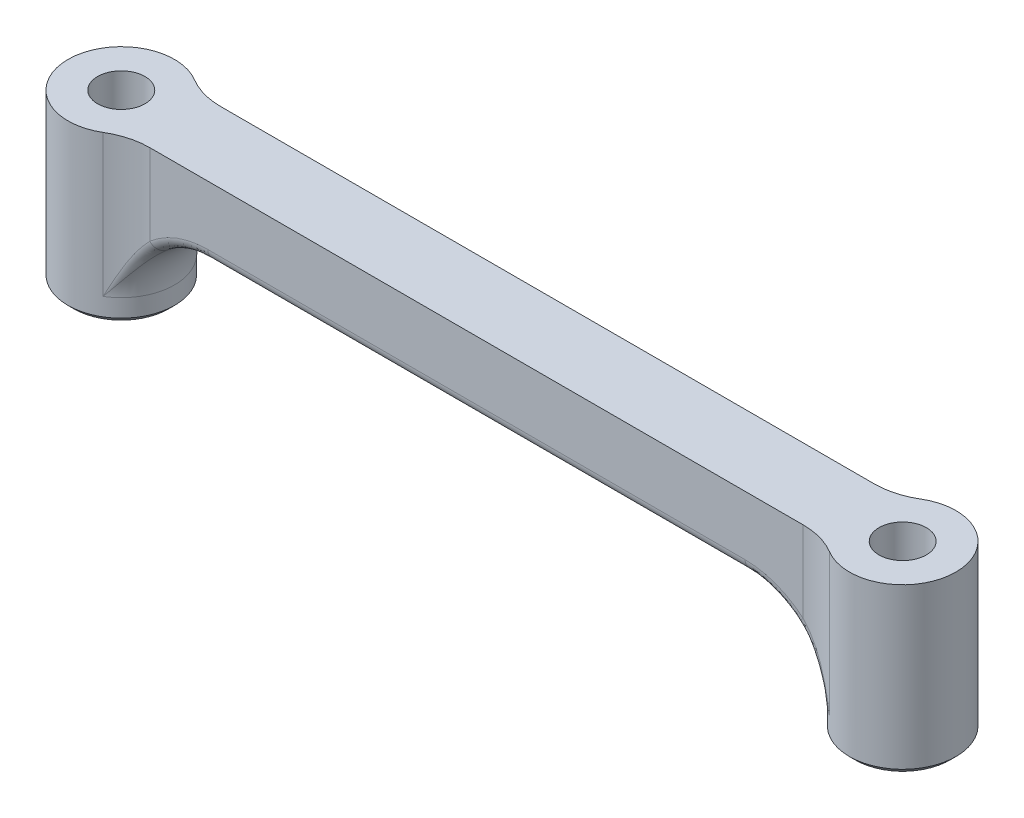
from build123d import *

# Parameters (mm, degrees)
SKETCH1_R           = 1.0000000000000016
BOSS_EXTRUDE1_DEPTH = 3
BOSS_EXTRUDE2_START = -4
SKETCH1_3_R         = 2.25
SKETCH1_3_R_2       = 1.0000000000000016
BOSS_EXTRUDE2_DEPTH = 4
FILLET1_R           = 3
FILLET2_R           = 0.5
CHAMFER1_SIZE       = 0.25


with BuildPart() as part:
    # Sketch1 → Boss-Extrude1 (new body)
    with BuildSketch(Plane(origin=(0, 0, 0), x_dir=(1, 0, 0), z_dir=(0, 1, 0))):
        with BuildLine():
            Line((0, 1.5), (-14.82294901687516, 1.5))
            ThreePointArc((-14.822949016875159, 1.5000000000000018), (-18.75, -7.2e-16), (-14.822949016875159, -1.5000000000000013))
            Line((-14.82294901687516, -1.5), (0, -1.5))
            Line((3.8e-16, -1.5), (3.8e-16, 1.5))
        make_face()
        with Locations((-16.5, 0)):
            Circle(SKETCH1_R, mode=Mode.SUBTRACT)
    extrude(amount=BOSS_EXTRUDE1_DEPTH)

    # Sketch1<3> → Boss-Extrude2 (add)
    with BuildSketch(Plane(origin=(0, 0, 0), x_dir=(1, 0, 0), z_dir=(0, 1, 0)).offset(BOSS_EXTRUDE2_START)):
        with Locations((-16.5, 2.2e-16)):
            Circle(SKETCH1_3_R)
        with Locations((-16.5, 0)):
            Circle(SKETCH1_3_R_2, mode=Mode.SUBTRACT)
    extrude(amount=BOSS_EXTRUDE2_DEPTH)

    # Fillet1
    fillet1_edges = [part.edges().sort_by_distance(p)[0] for p in [
        (-14.39811219233389, 0, 0.8028497019894529),
        (-14.82294901687516, 1.5, -1.5000000000000009),
        (-14.82294901687516, 1.5, 1.5000000000000007),
    ]]
    fillet(fillet1_edges, radius=FILLET1_R)

    # Mirror1: part across plane


with BuildPart() as part_1:
    add(part.part)
    add(part.part.mirror(Plane(origin=(0, 3, 0), x_dir=(0, 0, 1), z_dir=(1, 0, 0))))

    # Fillet2
    fillet2_edges = [part_1.edges().sort_by_distance(p)[0] for p in [
        (-14.659651720135143, -1.90632691886055, -1.627053194004321),
        (-12.716820517675503, -0.241941137387509, -1.5),
        (14.659651720135143, -1.90632691886055, -1.627053194004321),
        (12.716820517675503, -0.241941137387509, -1.5),
        (-14.659651720130464, -1.9063269188539944, 1.6270531940029231),
        (-12.716820517645136, -0.24194113741398005, 1.5),
        (14.659651720130464, -1.9063269188539944, 1.6270531940029231),
        (12.716820517645136, -0.24194113741398005, 1.5),
        (0, 0, -1.4999999999999991),
        (0, 0, 1.4999999999999993),
    ]]
    fillet(fillet2_edges, radius=FILLET2_R)

    # Chamfer1
    chamfer1_edges = [part_1.edges().sort_by_distance(p)[0] for p in [
        (-18.75, -4, -5e-16),
        (18.75, -4, -5e-16),
    ]]
    chamfer(chamfer1_edges, length=CHAMFER1_SIZE)


solid = part_1.part
